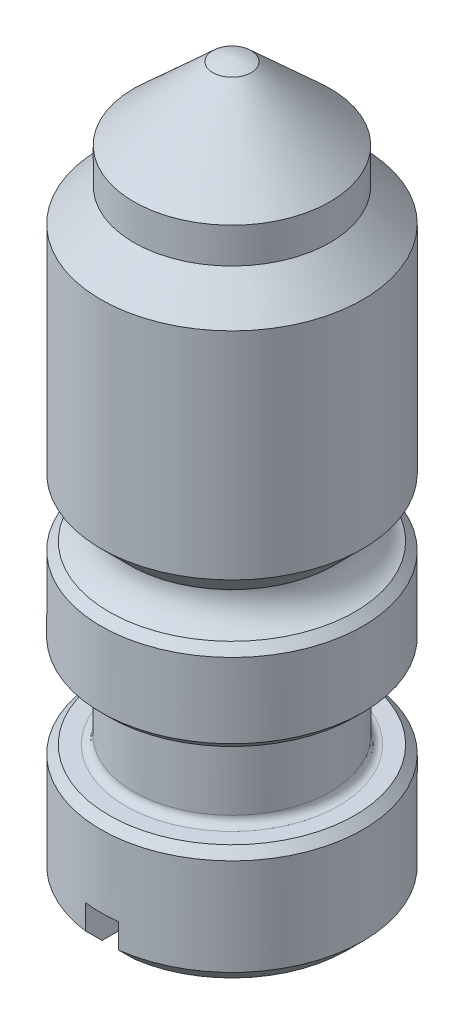
from build123d import *

# Parameters (mm, degrees)
REDONDEO1_R           = 0.25
CHAFL_N7_SIZE         = 0.25
CHAFL_N9_SIZE         = 0.5
CROQUIS1_W            = 1
CROQUIS1_H            = 1.25
CORTAR_EXTRUIR1_DEPTH = 40
REDONDEO2_R           = 1


with BuildPart() as part:
    # Sketch1 → Revolve1 (revolve)
    with BuildSketch(Plane.XY):
        with BuildLine():
            Line((0, 0), (-3.99720796, 0))
            Line((-3.99720796, 0), (-3.99720796, 3.695721343))
            Line((-3.99720796, 3.695721343), (-3, 3.695721343))
            Line((-3, 3.695721343), (-3, 6.290801943))
            Line((-3, 6.290801943), (-3.996490616, 6.290801943))
            Line((-3.996490616, 6.290801943), (-3.996490616, 9.069605063))
            Line((-3.996490616, 9.069605063), (-3.13, 9.069605063))
            Line((-3.13, 9.069605063), (-3.13, 10))
            Line((-3.13, 10), (-3.997062109, 10.867062109))
            Line((-3.997062109, 10.867062109), (-3.997062109, 17.446452736))
            Line((-3.997062109, 17.446452736), (-2.993514845, 18.45))
            Line((-2.993514845, 18.45), (-2.993514845, 19.528543236))
            Line((-2.993514845, 19.528543236), (-0.584226233, 21.734587674))
            ThreePointArc((-0.584226233, 21.734587674), (-0.297614848, 21.830829517), (0, 21.884064665))
            Line((0, 21.884064665), (0, 0))
        make_face()
    revolve(axis=Axis((0, 21.884064665, 0), (0, -1, 0)))

    # Redondeo1
    redondeo1_edges = [part.edges().sort_by_distance(p)[0] for p in [
        (3, 6.290801943, 0),
        (3, 3.695721343, 0),
    ]]
    fillet(redondeo1_edges, radius=REDONDEO1_R)

    # Chaflán7
    chafl_n7_edges = [part.edges().sort_by_distance(p)[0] for p in [
        (3.996490616, 9.069605063, 0),
        (3.996490616, 6.290801943, 0),
        (3.99720796, 3.695721343, 0),
    ]]
    chamfer(chafl_n7_edges, length=CHAFL_N7_SIZE)

    # Chaflán9
    chafl_n9_edges = [part.edges().sort_by_distance(p)[0] for p in [
        (3.99720796, 0, 0),
    ]]
    chamfer(chafl_n9_edges, length=CHAFL_N9_SIZE)

    # Croquis1 → Cortar-Extruir1 (cut)
    with BuildSketch(Plane.XY.offset(10)):
        with Locations((0, 0.625)):
            Rectangle(CROQUIS1_W, CROQUIS1_H)
    extrude(amount=-CORTAR_EXTRUIR1_DEPTH, mode=Mode.SUBTRACT)

    # Redondeo2
    # the kernel refuses this fillet: 1 mm, written as the material it adds along each edge
    with BuildSketch(Plane(origin=(0, 9.069605063, 0), x_dir=(-1, 0, 0), z_dir=(0, 0, 1))) as redondeo2_piece_1:
        with BuildLine():
            CenterArc((4.13, -0.923536979), REDONDEO2_R, 112.55123215, 67.44876785)
            Line((3.13, -0.923536979), (3.11, -0.923536979))
            Line((3.11, -0.923536979), (3.11, 0))
            Line((3.11, 0), (3.13, 0.02))
            ThreePointArc((3.13, 0.02), (3.438245308, 0.02), (3.738820428, 0.01847074))
            Line((3.738820428, 0.01847074), (3.746490616, 0))
        make_face()
    revolve(axis=Axis((0, 9.069605063, 0), (0, -1, 0)))


solid = part.part
